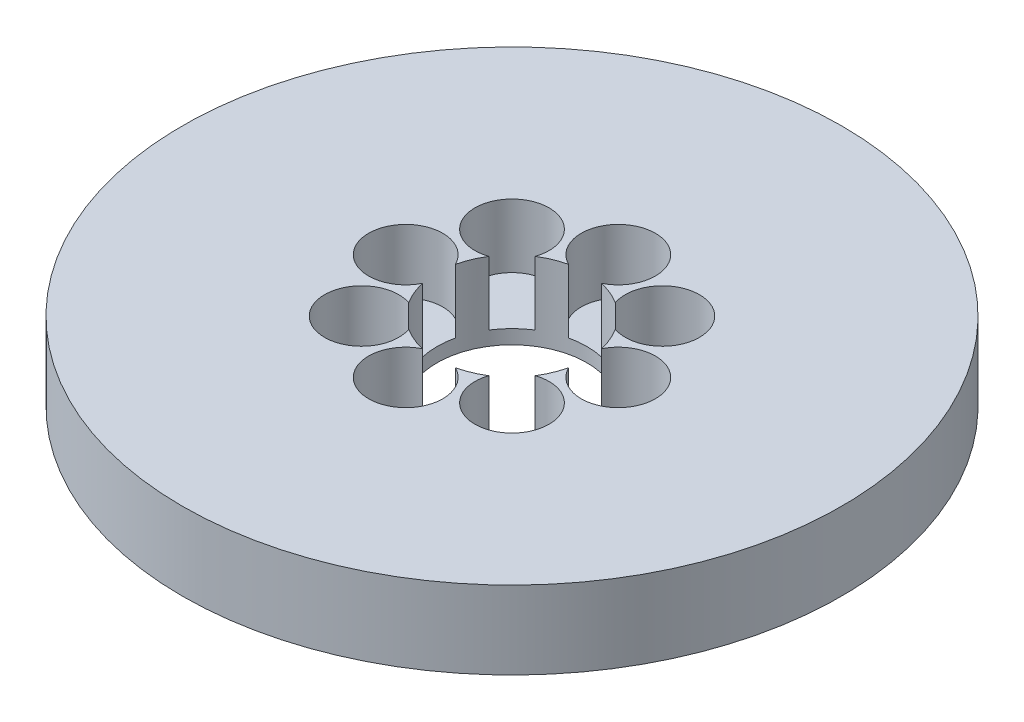
from build123d import *

# Parameters (mm, degrees)
SKETCH1_R           = 55
BOSS_EXTRUDE1_DEPTH = 13
SKETCH2_R           = 12.5
CUT_EXTRUDE1_DEPTH  = 79.860636569
SKETCH3_R           = 6.187558348
CUT_EXTRUDE2_DEPTH  = 10.648204591
CIRPATTERN1_COUNT   = 8


with BuildPart() as part:
    # Sketch1 → Boss-Extrude1 (new body)
    with BuildSketch(Plane(origin=(0, 0, 0), x_dir=(1, 0, 0), z_dir=(0, 1, 0))):
        Circle(SKETCH1_R)
    extrude(amount=BOSS_EXTRUDE1_DEPTH)

    # Sketch2 → Cut-Extrude1 (cut, through all)
    with BuildSketch(Plane(origin=(0, 0, 0), x_dir=(1, 0, 0), z_dir=(0, 1, 0))):
        Circle(SKETCH2_R)
    extrude(amount=CUT_EXTRUDE1_DEPTH, mode=Mode.SUBTRACT)

    # Sketch3 → Cut-Extrude2 (cut)
    with BuildSketch(Plane(origin=(0, 13, 0), x_dir=(1, 0, 0), z_dir=(0, 1, 0))):
        with Locations((-17.7436626, 0)):
            Circle(SKETCH3_R)
    cut_extrude2 = extrude(amount=-CUT_EXTRUDE2_DEPTH, mode=Mode.SUBTRACT)

    # CirPattern1: Cut-Extrude2 ×8 about axis
    cirpattern1_axis = Axis((0, 0, 0), (0, 1, 0))
    for i in range(1, CIRPATTERN1_COUNT):
        add(cut_extrude2.rotate(cirpattern1_axis, i * 360 / CIRPATTERN1_COUNT), mode=Mode.SUBTRACT)


solid = part.part
